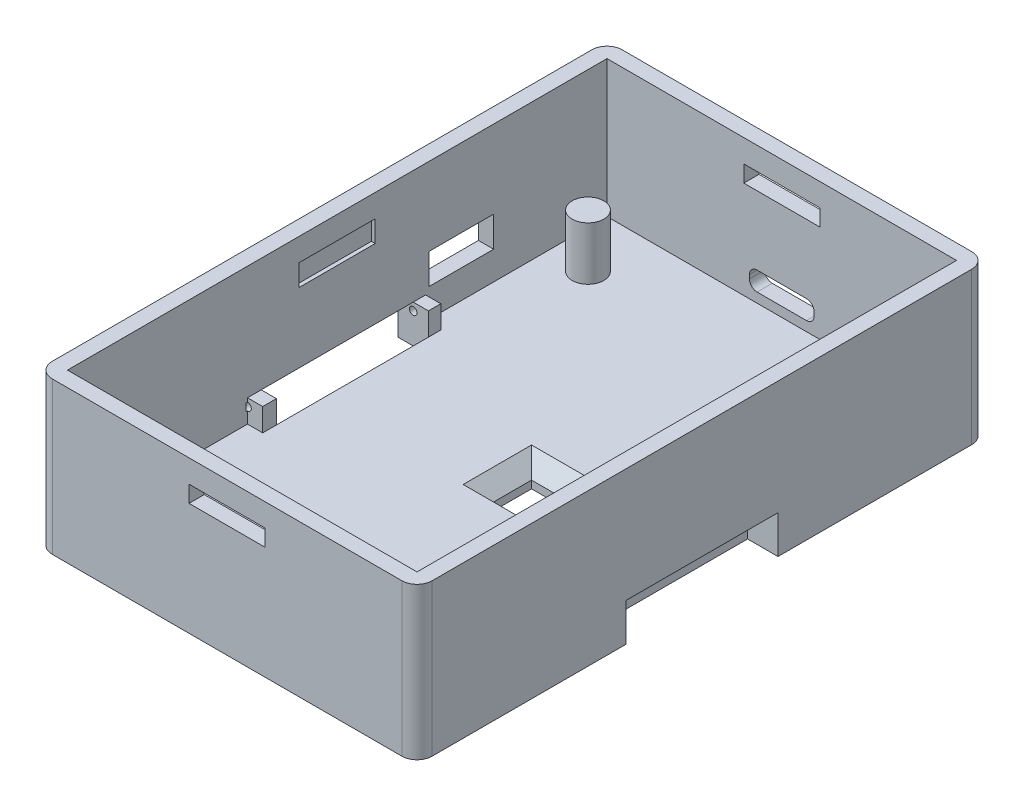
from build123d import *

# Parameters (mm, degrees)
SKETCH1_W           = 50
SKETCH1_H           = 75
BOSS_EXTRUDE1_DEPTH = 20
SHELL1_T            = -2
FILLET1_R           = 2
SKETCH2_R           = 12.5
BOSS_EXTRUDE2_DEPTH = 1
FILLET2_R           = 2
CUT_EXTRUDE1_DEPTH  = 5
SKETCH4_R           = 2.084715902
SKETCH4_R_2         = 2.544136108
SKETCH4_R_3         = 2.861924979
SKETCH4_R_4         = 2.414925707
BOSS_EXTRUDE3_DEPTH = 7
CHAMFER1_SIZE       = 2
CUT_EXTRUDE2_DEPTH  = 4
SKETCH7_W           = 2
SKETCH7_H           = 1.627577662
BOSS_EXTRUDE4_DEPTH = 3
SKETCH8_W           = 2
SKETCH8_H           = 1.808898565
BOSS_EXTRUDE5_DEPTH = 3
SKETCH9_R           = 0.5
CUT_EXTRUDE3_DEPTH  = 2
CUT_EXTRUDE4_START  = -2
CUT_EXTRUDE4_DEPTH  = 2
SKETCH12_W          = 8.5
SKETCH12_H          = 4
CUT_EXTRUDE5_DEPTH  = 3
SKETCH14_W          = 10
SKETCH14_H          = 2.18902829
CUT_EXTRUDE7_DEPTH  = 3
SKETCH15_W          = 10
SKETCH15_H          = 2.825004844
CUT_EXTRUDE8_DEPTH  = 0.5
CUT_EXTRUDE9_DEPTH  = 3


with BuildPart() as part:
    # Sketch1 → Boss-Extrude1 (new body)
    with BuildSketch(Plane(origin=(0, 0, 0), x_dir=(1, 0, 0), z_dir=(0, 1, 0))):
        with Locations((25, 37.5)):
            Rectangle(SKETCH1_W, SKETCH1_H)
    extrude(amount=BOSS_EXTRUDE1_DEPTH)

    # Shell1
    shell1_openings = [part.faces().sort_by_distance(p)[0] for p in [
        (25, 20, -37.5),
    ]]
    offset(amount=SHELL1_T, openings=shell1_openings, kind=Kind.INTERSECTION)

    # Fillet1
    fillet1_edges = [part.edges().sort_by_distance(p)[0] for p in [
        (0, 10, -75),
        (50, 10, -75),
        (50, 10, 0),
        (0, 10, 0),
    ]]
    fillet(fillet1_edges, radius=FILLET1_R)

    # Sketch2 → Boss-Extrude2 (add)
    with BuildSketch(Plane.XZ):
        with Locations(Location((25, -37.5, 0), (0, 0, 270))):
            Circle(SKETCH2_R)
    extrude(amount=BOSS_EXTRUDE2_DEPTH)

    # Fillet2
    # the kernel refuses this fillet: 2 mm, written as the material it takes off along each edge
    with BuildSketch(Plane(origin=(25, -1, -37.5), x_dir=(0, 0, -1), z_dir=(-1, 0, 0))) as fillet2_piece_1:
        with BuildLine():
            CenterArc((10.767949192, -2), FILLET2_R, 30, 60)
            Line((10.767949192, 0), (10.767949192, 0.04))
            Line((10.767949192, 0.04), (12.5, 0.04))
            Line((12.5, 0.04), (12.54, 0))
            ThreePointArc((12.54, 0), (12.54, -0.5), (12.534641016, -0.98))
            Line((12.534641016, -0.98), (12.5, -1))
        make_face()
    revolve(axis=Axis((25, -1, -37.5), (0, -1, 0)), mode=Mode.SUBTRACT)

    # Sketch3 → Cut-Extrude1 (cut)
    with BuildSketch(Plane.XZ.offset(1)):
        Polygon((33, -40), (33, -37.5), (33, -35), (25.072423756, -35), (25.072423756, -37.5), (25.072423756, -40), align=None)
    extrude(amount=-CUT_EXTRUDE1_DEPTH, mode=Mode.SUBTRACT)

    # Sketch4 → Boss-Extrude3 (add)
    with BuildSketch(Plane(origin=(0, 2, 0), x_dir=(1, 0, 0), z_dir=(0, 1, 0))):
        with Locations(Location((7, 65.5, 0), (0, 0, 90))):
            Circle(SKETCH4_R)
        with Locations(Location((43, 65.5, 0), (0, 0, 90))):
            Circle(SKETCH4_R_2)
        with Locations(Location((43, 9.5, 0), (0, 0, 90))):
            Circle(SKETCH4_R_3)
        with Locations(Location((7, 9.5, 0), (0, 0, 90))):
            Circle(SKETCH4_R_4)
    extrude(amount=BOSS_EXTRUDE3_DEPTH)

    # Chamfer1
    chamfer1_edges = [part.edges().sort_by_distance(p)[0] for p in [
        (33, 2, -37.5),
        (29.036211878, 2, -40),
        (29.036211878, 2, -35),
        (25.072423756, 2, -37.5),
    ]]
    chamfer(chamfer1_edges, length=CHAMFER1_SIZE)

    # Sketch5 → Cut-Extrude2 (cut)
    with BuildSketch(Plane.ZY):
        Polygon((-37.5, 0), (-27.5, 0), (-27.5, 5), (-47.5, 5), (-47.5, 0), align=None)
    cut_extrude2 = extrude(amount=-CUT_EXTRUDE2_DEPTH, mode=Mode.SUBTRACT)

    # Sketch7 → Boss-Extrude4 (add)
    with BuildSketch(Plane(origin=(0, 2, 0), x_dir=(1, 0, 0), z_dir=(0, 1, 0))):
        with Locations((3, 48.313788831)):
            Rectangle(SKETCH7_W, SKETCH7_H)
    boss_extrude4 = extrude(amount=BOSS_EXTRUDE4_DEPTH)

    # Sketch8 → Boss-Extrude5 (add)
    with BuildSketch(Plane(origin=(0, 2, 0), x_dir=(1, 0, 0), z_dir=(0, 1, 0))):
        with Locations((3, 26.595550718)):
            Rectangle(SKETCH8_W, SKETCH8_H)
    boss_extrude5 = extrude(amount=BOSS_EXTRUDE5_DEPTH)

    # Sketch9 → Cut-Extrude3 (cut)
    with BuildSketch(Plane.XY.offset(-47.5)):
        with Locations((2, 4)):
            Circle(SKETCH9_R)
    cut_extrude3 = extrude(amount=-CUT_EXTRUDE3_DEPTH, mode=Mode.SUBTRACT)

    # Sketch10 → Cut-Extrude4 (cut)
    with BuildSketch(Plane(origin=(0, 0, -27.5), x_dir=(-1, 0, 0), z_dir=(0, 0, -1)).offset(CUT_EXTRUDE4_START)):
        with BuildLine():
            ThreePointArc((-1.5, 4), (-1.646446609, 4.353553391), (-2, 4.5))
            Line((-2, 4.5), (-2, 3.5))
            ThreePointArc((-2, 3.5), (-1.646446609, 3.646446609), (-1.5, 4))
        make_face()
        with BuildLine():
            Line((-2, 3.5), (-2, 4.5))
            ThreePointArc((-2, 4.5), (-2.5, 4), (-2, 3.5))
        make_face()
    cut_extrude4 = extrude(amount=CUT_EXTRUDE4_DEPTH, mode=Mode.SUBTRACT)

    # Mirror1: Cut-Extrude2, Boss-Extrude4, Boss-Extrude5, Cut-Extrude3, Cut-Extrude4 across plane
    add(cut_extrude2.mirror(Plane(origin=(25, 0, 0), x_dir=(0, 0, 1), z_dir=(1, 0, 0))), mode=Mode.SUBTRACT)
    add(boss_extrude4.mirror(Plane(origin=(25, 0, 0), x_dir=(0, 0, 1), z_dir=(1, 0, 0))))
    add(boss_extrude5.mirror(Plane(origin=(25, 0, 0), x_dir=(0, 0, 1), z_dir=(1, 0, 0))))
    add(cut_extrude3.mirror(Plane(origin=(25, 0, 0), x_dir=(0, 0, 1), z_dir=(1, 0, 0))), mode=Mode.SUBTRACT)
    add(cut_extrude4.mirror(Plane(origin=(25, 0, 0), x_dir=(0, 0, 1), z_dir=(1, 0, 0))), mode=Mode.SUBTRACT)

    # Sketch12 → Cut-Extrude5 (cut)
    with BuildSketch(Plane.ZY):
        with Locations((-53.834118064, 7.735405472)):
            Rectangle(SKETCH12_W, SKETCH12_H)
    extrude(amount=-CUT_EXTRUDE5_DEPTH, mode=Mode.SUBTRACT)

    # Sketch14 → Cut-Extrude7 (cut)
    with BuildSketch(Plane(origin=(0, 0, -2), x_dir=(-1, 0, 0), z_dir=(0, 0, -1))):
        with Locations((-25, 15.905485855)):
            Rectangle(SKETCH14_W, SKETCH14_H)
    cut_extrude7 = extrude(amount=-CUT_EXTRUDE7_DEPTH, mode=Mode.SUBTRACT)

    # Sketch15 → Cut-Extrude8 (cut)
    with BuildSketch(Plane(origin=(2, 0, 0), x_dir=(0, 0, -1), z_dir=(1, 0, 0))):
        with Locations((37.5, 15.587497578)):
            Rectangle(SKETCH15_W, SKETCH15_H)
    cut_extrude8 = extrude(amount=-CUT_EXTRUDE8_DEPTH, mode=Mode.SUBTRACT)

    # Mirror2: Cut-Extrude7 across plane
    add(cut_extrude7.mirror(Plane.XY.offset(-37.5)), mode=Mode.SUBTRACT)

    # Mirror3: Cut-Extrude8 across plane
    add(cut_extrude8.mirror(Plane(origin=(25, 0, 0), x_dir=(0, 0, 1), z_dir=(1, 0, 0))), mode=Mode.SUBTRACT)

    # Sketch16 → Cut-Extrude9 (cut)
    with BuildSketch(Plane(origin=(0, 0, -75), x_dir=(-1, 0, 0), z_dir=(0, 0, -1))):
        with BuildLine():
            Line((-28.25, 5.769790366), (-21.75, 5.769790366))
            ThreePointArc((-21.75, 5.769790366), (-21.042893219, 5.476897147), (-20.75, 4.769790366))
            Line((-20.75, 4.769790366), (-20.75, 4.269790366))
            ThreePointArc((-20.75, 4.269790366), (-21.042893219, 3.562683585), (-21.75, 3.269790366))
            Line((-21.75, 3.269790366), (-28.25, 3.269790366))
            ThreePointArc((-28.25, 3.269790366), (-28.957106781, 3.562683585), (-29.25, 4.269790366))
            Line((-29.25, 4.269790366), (-29.25, 4.769790366))
            ThreePointArc((-29.25, 4.769790366), (-28.957106781, 5.476897147), (-28.25, 5.769790366))
        make_face()
    extrude(amount=-CUT_EXTRUDE9_DEPTH, mode=Mode.SUBTRACT)


solid = part.part
